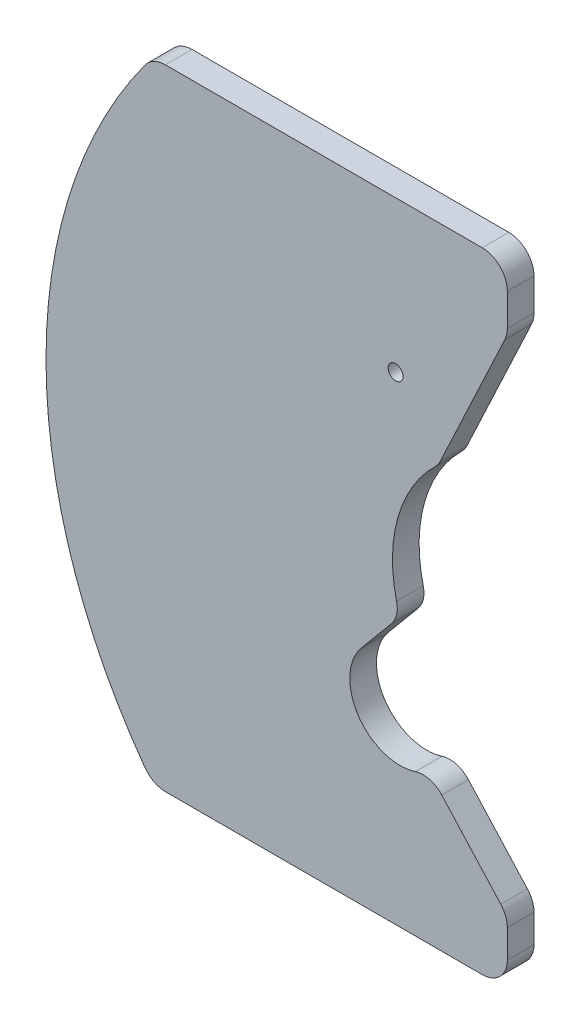
from build123d import *

# Parameters (mm, degrees)
SKETCH1_R           = 0.889
BOSS_EXTRUDE1_DEPTH = 3.175
FILLET1_R           = 3


with BuildPart() as part:
    # Sketch1 → Boss-Extrude1 (new body)
    with BuildSketch(Plane.XY):
        with BuildLine():
            Line((-15.137359122, 37.5), (-57.387359122, 37.5))
            ThreePointArc((-57.387359122, 37.5), (-70.10416265, -0.004807724), (-57.35903611, -37.5))
            Line((-57.35903611, -37.5), (-15.137359122, -37.5))
            Line((-15.137359122, -37.5), (-15.137359122, -30))
            Line((-15.137359122, -30), (-24.454232056, -19.726100177))
            ThreePointArc((-24.454232056, -19.726100177), (-32.321991252, -18.88915371), (-32.519153627, -10.979460849))
            Line((-32.519153627, -10.979460849), (-27.922607376, -5.466840166))
            ThreePointArc((-27.922607376, -5.466840166), (-28.301486723, 4.189647623), (-23.35327626, 12.490642695))
            Line((-23.35327626, 12.490642695), (-15.137359122, 30))
            Line((-15.137359122, 30), (-15.137359122, 37.5))
        make_face()
        with Locations((-28.448323012, 19.5)):
            Circle(SKETCH1_R, mode=Mode.SUBTRACT)
    extrude(amount=BOSS_EXTRUDE1_DEPTH)

    # Fillet1
    fillet1_edges = [part.edges().sort_by_distance(p)[0] for p in [
        (-15.137359122, 37.5, 1.5875),
        (-57.387359122, 37.5, 1.5875),
        (-57.35903611, -37.5, 1.5875),
        (-15.137359122, -37.5, 1.5875),
        (-15.137359122, -30, 1.5875),
        (-24.454232056, -19.726100177, 1.5875),
        (-27.922607376, -5.466840166, 1.5875),
        (-23.35327626, 12.490642695, 1.5875),
        (-15.137359122, 30, 1.5875),
    ]]
    fillet(fillet1_edges, radius=FILLET1_R)


solid = part.part
